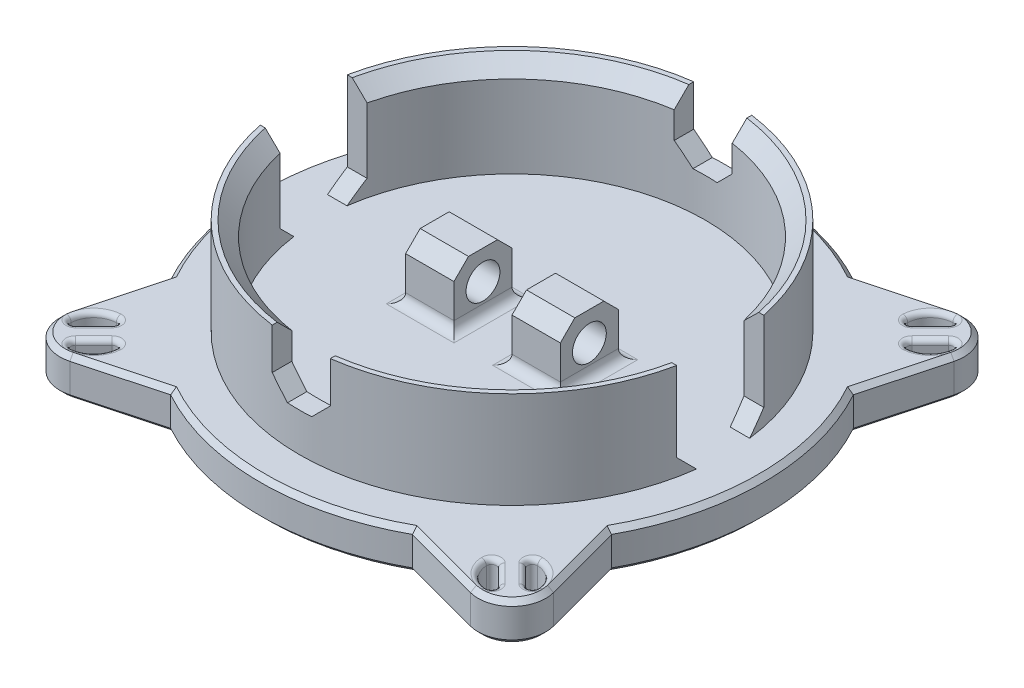
from build123d import *

# Parameters (mm, degrees)
BOSS_EXTRUDE1_DEPTH      = 4
SKETCH2_R                = 22
SKETCH2_R_2              = 20
BOSS_EXTRUDE2_DEPTH      = 10
CHAMFER1_SIZE            = 1.5
CHAMFER2_SIZE            = 0.5
CUT_EXTRUDE1_DEPTH       = 40.344631146
CUT_EXTRUDE1_DEPTH_BACK  = 40.344631146
SKETCH3_W                = 9
SKETCH3_H                = 10
SKETCH4_W                = 5
SKETCH4_H                = 6
BOSS_EXTRUDE3_DEPTH      = 6
CUT_EXTRUDE2_REACH       = 47.033
SKETCH5_R                = 1.75
CHAMFER3_SIZE            = 1.5
CUT_EXTRUDE9_DEPTH       = 40.344631146
MIRROR2_COPY_1_DEPTH     = 40.344631146
CUT_EXTRUDE10_DEPTH      = 40.344631146
CUT_EXTRUDE10_DEPTH_BACK = 40.344631146
SKETCH15_W               = 6
SKETCH15_H               = 6
CHAMFER4_SIZE            = 1.75
FILLET2_R                = 1
FILLET4_R                = 0.5
FILLET5_R                = 0.5


with BuildPart() as part:
    # Sketch1 → Boss-Extrude1 (new body)
    with BuildSketch(Plane(origin=(0, 0, 0), x_dir=(1, 0, 0), z_dir=(0, 1, 0))):
        with BuildLine():
            Line((-25.005184074, -20.71705968), (-22.79802623, -12.5))
            ThreePointArc((-22.79802623, -12.5), (-26, 0), (-22.79802623, 12.5))
            Line((-22.79802623, 12.5), (-25.005184074, 20.71705968))
            ThreePointArc((-25.005184074, 20.71705968), (-24.099873734, 24.099873734), (-20.71705968, 25.005184074))
            Line((-20.71705968, 25.005184074), (-12.5, 22.79802623))
            ThreePointArc((-12.5, 22.79802623), (0, 26), (12.5, 22.79802623))
            Line((12.5, 22.79802623), (20.71705968, 25.005184074))
            ThreePointArc((20.71705968, 25.005184074), (24.099873734, 24.099873734), (25.005184074, 20.71705968))
            Line((25.005184074, 20.71705968), (22.79802623, 12.5))
            ThreePointArc((22.79802623, 12.5), (26, 0), (22.79802623, -12.5))
            Line((22.79802623, -12.5), (25.005184074, -20.71705968))
            ThreePointArc((25.005184074, -20.71705968), (24.099873734, -24.099873734), (20.71705968, -25.005184074))
            Line((20.71705968, -25.005184074), (12.5, -22.79802623))
            ThreePointArc((12.5, -22.79802623), (0, -26), (-12.5, -22.79802623))
            Line((-12.5, -22.79802623), (-20.71705968, -25.005184074))
            ThreePointArc((-20.71705968, -25.005184074), (-24.099873734, -24.099873734), (-25.005184074, -20.71705968))
        make_face()
    extrude(amount=BOSS_EXTRUDE1_DEPTH)

    # Sketch2 → Boss-Extrude2 (add)
    with BuildSketch(Plane(origin=(0, 4, 0), x_dir=(1, 0, 0), z_dir=(0, 1, 0))):
        with Locations(Location((0, 0, 0), (0, 0, 90))):
            Circle(SKETCH2_R)
        with Locations(Location((0, 0, 0), (0, 0, 270))):
            Circle(SKETCH2_R_2, mode=Mode.SUBTRACT)
    extrude(amount=BOSS_EXTRUDE2_DEPTH)

    # Chamfer1
    chamfer1_edges = [part.edges().sort_by_distance(p)[0] for p in [
        (0, 14, -20),
    ]]
    chamfer(chamfer1_edges, length=CHAMFER1_SIZE)

    # Chamfer2
    chamfer2_edges = [part.edges().sort_by_distance(p)[0] for p in [
        (26, 4, 0),
        (16.60852984, 0, 23.901605152),
        (0, 0, 26),
        (-16.60852984, 0, 23.901605152),
        (23.901605152, 4, -16.60852984),
        (-24.099873734, 0, 24.099873734),
        (-23.901605152, 0, 16.60852984),
        (-26, 0, 0),
        (-23.901605152, 0, -16.60852984),
        (-24.099873734, 0, -24.099873734),
        (-16.60852984, 0, -23.901605152),
        (0, 0, -26),
        (16.60852984, 0, -23.901605152),
        (24.099873734, 0, -24.099873734),
        (23.901605152, 0, -16.60852984),
        (24.099873734, 4, -24.099873734),
        (26, 0, 0),
        (23.901605152, 0, 16.60852984),
        (24.099873734, 0, 24.099873734),
        (16.60852984, 4, -23.901605152),
        (0, 4, -26),
        (-16.60852984, 4, -23.901605152),
        (-24.099873734, 4, -24.099873734),
        (-23.901605152, 4, -16.60852984),
        (-26, 4, 0),
        (-23.901605152, 4, 16.60852984),
        (24.099873734, 4, 24.099873734),
        (-24.099873734, 4, 24.099873734),
        (-16.60852984, 4, 23.901605152),
        (0, 4, 26),
        (16.60852984, 4, 23.901605152),
        (23.901605152, 4, 16.60852984),
    ]]
    chamfer(chamfer2_edges, length=CHAMFER2_SIZE)

    # Sketch3 → Cut-Extrude1 (cut, two sides: drawn at the far end of the back side and taken through both)
    with BuildSketch(Plane(origin=(0, 0, 0), x_dir=(0, 0, -1), z_dir=(1, 0, 0)).offset(-CUT_EXTRUDE1_DEPTH_BACK)):
        with Locations((0, 9)):
            Rectangle(SKETCH3_W, SKETCH3_H)
    extrude(amount=CUT_EXTRUDE1_DEPTH + CUT_EXTRUDE1_DEPTH_BACK, mode=Mode.SUBTRACT)

    # Sketch4 → Boss-Extrude3 (add)
    with BuildSketch(Plane(origin=(0, 4, 0), x_dir=(1, 0, 0), z_dir=(0, 1, 0))):
        with Locations((-5.5, 0)):
            Rectangle(SKETCH4_W, SKETCH4_H)
        with Locations((5.5, 0)):
            Rectangle(SKETCH4_W, SKETCH4_H)
    extrude(amount=BOSS_EXTRUDE3_DEPTH)

    # Cut-Extrude2: up to this face of the body (flat: up to its plane)
    cut_extrude2_end = Plane(part.part.faces().sort_by_distance((8, 7, 0))[0])
    # Sketch5 → Cut-Extrude2 (cut, up to the picked face)
    with BuildSketch(Plane.ZY.offset(8), mode=Mode.PRIVATE) as cut_extrude2_sk1:
        with Locations((0, 7)):
            Circle(SKETCH5_R)
    cut_extrude2_tool1 = split(extrude(cut_extrude2_sk1.sketch, amount=-CUT_EXTRUDE2_REACH, mode=Mode.PRIVATE), bisect_by=cut_extrude2_end, keep=Keep.BOTH, mode=Mode.PRIVATE)
    add(cut_extrude2_tool1.solids().sort_by(Axis((-8, 7, 0), (1, 0, 0)))[0], mode=Mode.SUBTRACT)

    # Chamfer3
    chamfer3_edges = [part.edges().sort_by_distance(p)[0] for p in [
        (-5.5, 10, -3),
        (-5.5, 10, 3),
        (5.5, 10, -3),
        (5.5, 10, 3),
    ]]
    chamfer(chamfer3_edges, length=CHAMFER3_SIZE)

    # Sketch14 → Cut-Extrude9 (cut, through all)
    with BuildSketch(Plane(origin=(0, 0, 0), x_dir=(1, 0, 0), z_dir=(0, 1, 0))):
        with BuildLine():
            Line((-23.952291956, 22.538078393), (-20.711921607, 19.297708044))
            ThreePointArc((-20.711921607, 19.297708044), (-23.392766953, 19.857233047), (-23.952291956, 22.538078393))
        make_face()
        with BuildLine():
            Line((-22.538078393, 23.952291956), (-19.297708044, 20.711921607))
            ThreePointArc((-19.297708044, 20.711921607), (-19.857233047, 23.392766953), (-22.538078393, 23.952291956))
        make_face()
    cut_extrude9 = extrude(amount=CUT_EXTRUDE9_DEPTH, mode=Mode.SUBTRACT)

    # Mirror1: Cut-Extrude9 across plane
    add(cut_extrude9.mirror(Plane.XY), mode=Mode.SUBTRACT)

    # Mirror2: Cut-Extrude9 across plane
    add(cut_extrude9.mirror(Plane(origin=(0, 0, 0), x_dir=(0, 0, 1), z_dir=(1, 0, 0))), mode=Mode.SUBTRACT)

    # Mirror2 copy 1 sketch → Mirror2 copy 1 (cut, through all)
    with BuildSketch(Plane(origin=(0, 0, 0), x_dir=(-1, 0, 0), z_dir=(0, 1, 0))):
        with BuildLine():
            Line((-23.952291956, 22.538078393), (-20.711921607, 19.297708044))
            ThreePointArc((-20.711921607, 19.297708044), (-23.392766953, 19.857233047), (-23.952291956, 22.538078393))
        make_face()
        with BuildLine():
            Line((-22.538078393, 23.952291956), (-19.297708044, 20.711921607))
            ThreePointArc((-19.297708044, 20.711921607), (-19.857233047, 23.392766953), (-22.538078393, 23.952291956))
        make_face()
    extrude(amount=MIRROR2_COPY_1_DEPTH, mode=Mode.SUBTRACT)

    # Sketch15 → Cut-Extrude10 (cut, two sides: drawn at the far end of the back side and taken through both)
    with BuildSketch(Plane.XY.offset(-CUT_EXTRUDE10_DEPTH_BACK)):
        with Locations((0, 11)):
            Rectangle(SKETCH15_W, SKETCH15_H)
    extrude(amount=CUT_EXTRUDE10_DEPTH + CUT_EXTRUDE10_DEPTH_BACK, mode=Mode.SUBTRACT)

    # Chamfer4
    chamfer4_edges = [part.edges().sort_by_distance(p)[0] for p in [
        (-20.511015369, 4, 4.5),
        (20.511015369, 4, 4.5),
        (20.511015369, 4, -4.5),
        (-20.511015369, 4, -4.5),
        (3, 8, 20.784107325),
        (3, 8, -20.784107325),
        (-3, 8, 20.784107325),
        (-3, 8, -20.784107325),
    ]]
    chamfer(chamfer4_edges, length=CHAMFER4_SIZE)

    # Fillet2
    fillet2_edges = [part.edges().sort_by_distance(p)[0] for p in [
        (-3, 4, 0),
        (-5.5, 4, -3),
        (-8, 4, 0),
        (-5.5, 4, 3),
        (8, 4, 0),
        (5.5, 4, -3),
        (3, 4, 0),
        (5.5, 4, 3),
    ]]
    fillet(fillet2_edges, radius=FILLET2_R)

    # Fillet4
    fillet4_edges = [part.edges().sort_by_distance(p)[0] for p in [
        (-19.297708044, 2, -20.711921607),
        (-22.538078393, 2, -23.952291956),
        (-23.952291956, 2, -22.538078393),
        (-20.711921607, 2, -19.297708044),
        (-22.538078393, 2, 23.952291956),
        (-19.297708044, 2, 20.711921607),
        (-20.711921607, 2, 19.297708044),
        (-23.952291956, 2, 22.538078393),
        (19.297708044, 2, 20.711921607),
        (22.538078393, 2, 23.952291956),
        (23.952291956, 2, 22.538078393),
        (20.711921607, 2, 19.297708044),
        (22.538078393, 2, -23.952291956),
        (19.297708044, 2, -20.711921607),
        (20.711921607, 2, -19.297708044),
        (23.952291956, 2, -22.538078393),
    ]]
    fillet(fillet4_edges, radius=FILLET4_R)

    # Fillet5
    fillet5_edges = [part.edges().sort_by_distance(p)[0] for p in [
        (-20.917893219, 0, 22.332106781),
        (-20.917893219, 4, 22.332106781),
        (-19.857233047, 0, 23.392766953),
        (-19.857233047, 4, 23.392766953),
        (-23.392766953, 0, 19.857233047),
        (-23.392766953, 4, 19.857233047),
        (-22.332106781, 0, 20.917893219),
        (-22.332106781, 4, 20.917893219),
        (22.332106781, 4, 20.917893219),
        (22.332106781, 0, 20.917893219),
        (23.392766953, 4, 19.857233047),
        (23.392766953, 0, 19.857233047),
        (19.857233047, 4, 23.392766953),
        (19.857233047, 0, 23.392766953),
        (20.917893219, 4, 22.332106781),
        (20.917893219, 0, 22.332106781),
        (22.332106781, 0, -20.917893219),
        (22.332106781, 4, -20.917893219),
        (23.392766953, 0, -19.857233047),
        (23.392766953, 4, -19.857233047),
        (19.857233047, 0, -23.392766953),
        (19.857233047, 4, -23.392766953),
        (20.917893219, 0, -22.332106781),
        (20.917893219, 4, -22.332106781),
        (-20.917893219, 4, -22.332106781),
        (-20.917893219, 0, -22.332106781),
        (-19.857233047, 4, -23.392766953),
        (-19.857233047, 0, -23.392766953),
        (-23.392766953, 4, -19.857233047),
        (-23.392766953, 0, -19.857233047),
        (-22.332106781, 4, -20.917893219),
        (-22.332106781, 0, -20.917893219),
        (-21.955473089, 0, 23.826793432),
        (-21.955473089, 4, 23.826793432),
        (-23.826793432, 0, 21.955473089),
        (-23.826793432, 4, 21.955473089),
        (-19.423206568, 0, 21.294526911),
        (-19.423206568, 4, 21.294526911),
        (-21.294526911, 0, 19.423206568),
        (-21.294526911, 4, 19.423206568),
        (23.826793432, 0, 21.955473089),
        (23.826793432, 4, 21.955473089),
        (21.955473089, 0, 23.826793432),
        (21.955473089, 4, 23.826793432),
        (21.294526911, 0, 19.423206568),
        (21.294526911, 4, 19.423206568),
        (19.423206568, 0, 21.294526911),
        (19.423206568, 4, 21.294526911),
        (21.294526911, 0, -19.423206568),
        (21.294526911, 4, -19.423206568),
        (19.423206568, 0, -21.294526911),
        (19.423206568, 4, -21.294526911),
        (23.826793432, 0, -21.955473089),
        (23.826793432, 4, -21.955473089),
        (21.955473089, 0, -23.826793432),
        (21.955473089, 4, -23.826793432),
        (-19.423206568, 0, -21.294526911),
        (-19.423206568, 4, -21.294526911),
        (-21.294526911, 0, -19.423206568),
        (-21.294526911, 4, -19.423206568),
        (-21.955473089, 0, -23.826793432),
        (-21.955473089, 4, -23.826793432),
        (-23.826793432, 0, -21.955473089),
        (-23.826793432, 4, -21.955473089),
    ]]
    fillet(fillet5_edges, radius=FILLET5_R - 0.0001)  # a hair under: the kernel refuses the full size


solid = part.part
